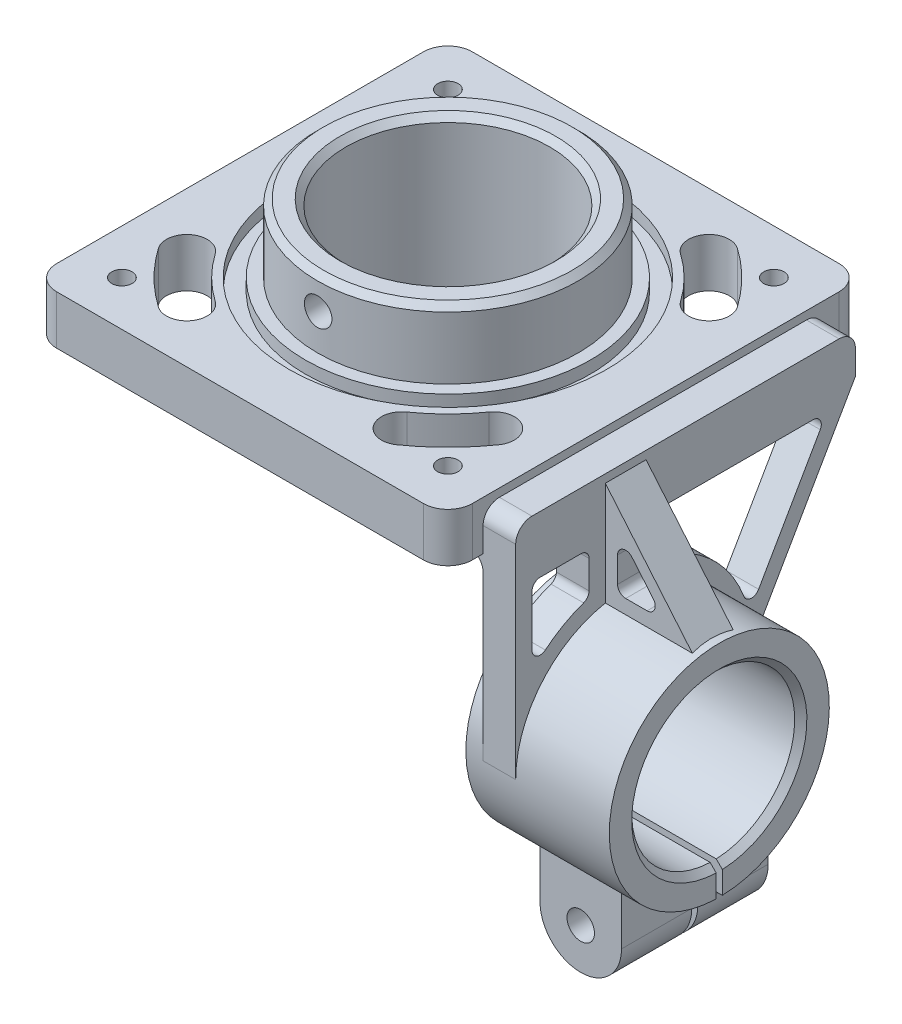
from build123d import *
from build123d.topology import SkipClean

# Parameters (mm, degrees)
ESQUISSE1_W                                        = 161.925
ESQUISSE1_H                                        = 161.925
ESQUISSE1_R                                        = 39.6875
BOSS_EXTRU_1_DEPTH                                 = 19.05
TROU_TARAUD_3_8_161_D                              = 7.9375
ESQUISSE4_R                                        = 61.9125
ESQUISSE4_R_2                                      = 55.5625
ENL_V_MAT_EXTRU_1_DEPTH                            = 4.7625
BOSS_EXTRU_2_START                                 = 26.67
ESQUISSE5_R                                        = 50.8
ESQUISSE5_R_2                                      = 39.6875
BOSS_EXTRU_2_DEPTH                                 = 26.67
CONG_1_R                                           = 9.525
TROU_TARAUD_1_2_131_REACH                          = 158.932
TROU_TARAUD_1_2_131_BORE_R                         = 5.35813
CHANFREIN2_SIZE                                    = 2.38125
ESQUISSE11_R                                       = 53.975
ESQUISSE11_R_2                                     = 39.6875
BOSS_EXTRU_3_DEPTH                                 = 19.05
CHANFREIN4_SIZE                                    = 2.38125
ESQUISSE13_R                                       = 31.75
BOSS_EXTRU_4_DEPTH                                 = 12.7
CONG_2_R                                           = 6.35
CONG_3_R                                           = 6.35
BOSS_EXTRU_6_START                                 = 6.7183
ESQUISSE18_R                                       = 42.8625
ESQUISSE18_R_2                                     = 31.75
BOSS_EXTRU_6_DEPTH                                 = 6.7183
ESQUISSE19_R                                       = 42.8625
ESQUISSE19_R_2                                     = 31.75
BOSS_EXTRU_7_DEPTH                                 = 36.4617
ENL_V_MAT_EXTRU_2_REACH                            = 235.26
NERVURE3_REACH                                     = 215.053
ESQUISSE22_WALL_W                                  = 479.89076251
ESQUISSE22_WALL_H                                  = 15.875
ENL_V_MAT_EXTRU_3_DEPTH                            = 218.087375238
BOSS_EXTRU_8_DEPTH                                 = 57.15
ENL_V_START                                        = -57.15
ENL_V_MAT_EXTRU_4_DEPTH                            = 57.15
ESQUISSE27_W                                       = 2.38125
ESQUISSE27_H                                       = 51.880934265
ENL_V_MAT_EXTRU_5_DEPTH                            = 275.437792492
TROU_TARAUD_1_2_132_D                              = 10.71626
TROU_TARAUD_1_2_132_DEPTH                          = 27.384375
CHANFREIN5_SIZE                                    = 2.38125
CHAMBRAGE_POUR_VIS_T_TE_RONDE_BOMB_E_1_D           = 13.49375
CHAMBRAGE_POUR_VIS_T_TE_RONDE_BOMB_E_1_DEPTH       = 27.384375
CHAMBRAGE_POUR_VIS_T_TE_RONDE_BOMB_E_1_CBORE_D     = 20.6375
CHAMBRAGE_POUR_VIS_T_TE_RONDE_BOMB_E_1_CBORE_DEPTH = 12.7


with BuildPart() as part:
    # Esquisse1 → Boss.-Extru.1 (new body)
    with BuildSketch(Plane(origin=(0, 0, 0), x_dir=(1, 0, 0), z_dir=(0, 1, 0))):
        Rectangle(ESQUISSE1_W, ESQUISSE1_H)
        with Locations(Location((0, 0, 0), (0, 0, 270))):
            Circle(ESQUISSE1_R, mode=Mode.SUBTRACT)
        with BuildLine():
            ThreePointArc((-46.438182228, 66.320597386), (-57.249132772, 57.249132772), (-66.320597386, 46.438182228))
            ThreePointArc((-66.320597386, 46.438182228), (-64.371340998, 35.383399913), (-53.316558683, 37.332656301))
            ThreePointArc((-53.316558683, 37.332656301), (-46.02381262, 46.02381262), (-37.332656301, 53.316558683))
            ThreePointArc((-37.332656301, 53.316558683), (-35.383399913, 64.371340998), (-46.438182228, 66.320597386))
        make_face(mode=Mode.SUBTRACT)
        with BuildLine():
            ThreePointArc((66.320597386, 46.438182228), (57.249132772, 57.249132772), (46.438182228, 66.320597386))
            ThreePointArc((46.438182228, 66.320597386), (35.383399913, 64.371340998), (37.332656301, 53.316558683))
            ThreePointArc((37.332656301, 53.316558683), (46.02381262, 46.02381262), (53.316558683, 37.332656301))
            ThreePointArc((53.316558683, 37.332656301), (64.371340998, 35.383399913), (66.320597386, 46.438182228))
        make_face(mode=Mode.SUBTRACT)
        with BuildLine():
            ThreePointArc((46.438182228, -66.320597386), (57.249132772, -57.249132772), (66.320597386, -46.438182228))
            ThreePointArc((66.320597386, -46.438182228), (64.371340998, -35.383399913), (53.316558683, -37.332656301))
            ThreePointArc((53.316558683, -37.332656301), (46.02381262, -46.02381262), (37.332656301, -53.316558683))
            ThreePointArc((37.332656301, -53.316558683), (35.383399913, -64.371340998), (46.438182228, -66.320597386))
        make_face(mode=Mode.SUBTRACT)
        with BuildLine():
            ThreePointArc((-66.320597386, -46.438182228), (-57.249132772, -57.249132772), (-46.438182228, -66.320597386))
            ThreePointArc((-46.438182228, -66.320597386), (-35.383399913, -64.371340998), (-37.332656301, -53.316558683))
            ThreePointArc((-37.332656301, -53.316558683), (-46.02381262, -46.02381262), (-53.316558683, -37.332656301))
            ThreePointArc((-53.316558683, -37.332656301), (-64.371340998, -35.383399913), (-66.320597386, -46.438182228))
        make_face(mode=Mode.SUBTRACT)
    extrude(amount=-BOSS_EXTRU_1_DEPTH)

    # Trou taraudé 3/8-161 (through all)
    with Locations(Plane(origin=(0, 0, 0), x_dir=(1, 0, 0), z_dir=(0, 1, 0))):
        with Locations((-63.5, 63.5), (63.5, 63.5), (-63.5, -63.5), (63.5, -63.5)):
            Hole(TROU_TARAUD_3_8_161_D / 2)

    # Esquisse4 → Enlèv. mat.-Extru.1 (cut)
    with BuildSketch(Plane(origin=(0, 0, 0), x_dir=(1, 0, 0), z_dir=(0, 1, 0))):
        with Locations(Location((0, 0, 0), (0, 0, 270))):
            Circle(ESQUISSE4_R)
        with Locations(Location((0, 0, 0), (0, 0, 270))):
            Circle(ESQUISSE4_R_2, mode=Mode.SUBTRACT)
    extrude(amount=-ENL_V_MAT_EXTRU_1_DEPTH, mode=Mode.SUBTRACT)

    # Esquisse5 → Boss.-Extru.2 (add)
    with BuildSketch(Plane(origin=(0, 0, 0), x_dir=(1, 0, 0), z_dir=(0, 1, 0)).offset(BOSS_EXTRU_2_START)):
        with Locations(Location((0, 0, 0), (0, 0, 270))):
            Circle(ESQUISSE5_R)
        with Locations(Location((0, 0, 0), (0, 0, 270))):
            Circle(ESQUISSE5_R_2, mode=Mode.SUBTRACT)
    extrude(amount=-BOSS_EXTRU_2_DEPTH)

    # Congé1
    cong_1_edges = [part.edges().sort_by_distance(p)[0] for p in [
        (80.9625, -9.525, 80.9625),
        (-80.9625, -9.525, 80.9625),
        (-80.9625, -9.525, -80.9625),
        (80.9625, -9.525, -80.9625),
    ]]
    fillet(cong_1_edges, radius=CONG_1_R)

    # Trou taraudé 1/2-131 bore → Trou taraudé 1/2-131 (cut, up to next)
    with BuildSketch(Plane.XY.offset(50.8), mode=Mode.PRIVATE) as trou_taraud_1_2_131_sk1:
        with Locations((0, 13.97)):
            Circle(TROU_TARAUD_1_2_131_BORE_R)
    trou_taraud_1_2_131_tool1 = extrude(trou_taraud_1_2_131_sk1.sketch, amount=-TROU_TARAUD_1_2_131_REACH, mode=Mode.PRIVATE) & part.part
    add(trou_taraud_1_2_131_tool1.solids().sort_by_distance((0, 13.97, 50.8))[0], mode=Mode.SUBTRACT)

    # Chanfrein2
    chanfrein2_edges = [part.edges().sort_by_distance(p)[0] for p in [
        (0, 26.67, -50.8),
        (0, 26.67, -39.6875),
    ]]
    chamfer(chanfrein2_edges, length=CHANFREIN2_SIZE)

    # Esquisse11 → Boss.-Extru.3 (add)
    with BuildSketch(Plane(origin=(0, -19.05, 0), x_dir=(-1, 0, 0), z_dir=(0, -1, 0))):
        with Locations(Location((0, 0, 0), (0, 0, 90))):
            Circle(ESQUISSE11_R)
        with Locations(Location((0, 0, 0), (0, 0, 270))):
            Circle(ESQUISSE11_R_2, mode=Mode.SUBTRACT)
    extrude(amount=BOSS_EXTRU_3_DEPTH)

    # Chanfrein4
    chanfrein4_edges = [part.edges().sort_by_distance(p)[0] for p in [
        (0, -38.1, -39.6875),
    ]]
    chamfer(chanfrein4_edges, length=CHANFREIN4_SIZE)

    # Esquisse13 → Boss.-Extru.4 (add)
    with BuildSketch(Plane(origin=(80.9625, 0, 0), x_dir=(0, 0, -1), z_dir=(1, 0, 0))):
        with BuildLine():
            Line((-67.2465, -88.9), (-67.2465, -3.175))
            Line((-67.2465, -3.175), (65.0875, -3.175))
            Line((65.0875, -3.175), (65.0875, -19.05))
            Line((65.0875, -19.05), (12.797587815, -110.22424521))
            ThreePointArc((12.797587815, -110.22424521), (-35.417995163, -130.317929173), (-67.2465, -88.9))
        make_face()
        with Locations((-24.384, -88.9)):
            Circle(ESQUISSE13_R, mode=Mode.SUBTRACT)
    extrude(amount=BOSS_EXTRU_4_DEPTH)

    # Congé2
    cong_2_edges = [part.edges().sort_by_distance(p)[0] for p in [
        (87.3125, -3.175, -65.0875),
        (87.3125, -3.175, 67.2465),
    ]]
    fillet(cong_2_edges, radius=CONG_2_R)

    # Congé3
    # the kernel refuses this fillet: 6.35 mm, written as the material it adds along each edge
    with BuildSketch(Plane(origin=(80.9625, -19.05, 67.2465), x_dir=(-1, 0, 0), z_dir=(0, 0, -1))) as cong_3_piece_1_section:
        with BuildLine():
            CenterArc((CONG_3_R, -CONG_3_R), CONG_3_R, 90, 90)
            Line((0, -CONG_3_R), (0, 0))
            Line((0, 0), (CONG_3_R, 0))
        make_face()
    cong_3_piece_1 = extrude(amount=148.209, mode=Mode.PRIVATE)
    cong_3_piece_1 = split(cong_3_piece_1, bisect_by=Plane(origin=(78.073418061, -76.067337116, -32.387130023), z_dir=(0, 0.4975035336358329, 0.8674619496092378)), keep=Keep.TOP, mode=Mode.PRIVATE)
    add(cong_3_piece_1)

    # Esquisse18 → Boss.-Extru.6 (add)
    with SkipClean():  # the faces are left unmerged after this step: merging them gives an invalid solid
        with BuildSketch(Plane.ZY.offset(-80.9625).offset(BOSS_EXTRU_6_START)):
            with Locations((24.384, -88.9)):
                Circle(ESQUISSE18_R)
            with Locations(Location((24.384, -88.9, 0), (0, 0, 180))):
                Circle(ESQUISSE18_R_2, mode=Mode.SUBTRACT)
        extrude(amount=-BOSS_EXTRU_6_DEPTH)

    # Esquisse19 → Boss.-Extru.7 (add)
    with BuildSketch(Plane(origin=(93.6625, 0, 0), x_dir=(0, 0, -1), z_dir=(1, 0, 0))):
        with Locations((-24.384, -88.9)):
            Circle(ESQUISSE19_R)
        with Locations((-24.384, -88.9)):
            Circle(ESQUISSE19_R_2, mode=Mode.SUBTRACT)
    extrude(amount=BOSS_EXTRU_7_DEPTH)

    # Esquisse20 → Enlèv. mat.-Extru.2 (cut, up to next)
    with BuildSketch(Plane(origin=(93.6625, 0, 0), x_dir=(0, 0, -1), z_dir=(1, 0, 0)), mode=Mode.PRIVATE) as enl_v_mat_extru_2_sk1:
        with BuildLine():
            Line((-10.0965, -39.508591334), (-10.0965, -28.575))
            ThreePointArc((-10.0965, -28.575), (-9.16656403, -26.32993597), (-6.9215, -25.4))
            Line((-6.9215, -25.4), (48.644448908, -25.4))
            ThreePointArc((48.644448908, -25.4), (51.391790492, -26.983541794), (51.398640598, -30.154573719))
            Line((51.398640598, -30.154573719), (27.393895624, -72.009960599))
            ThreePointArc((27.393895624, -72.009960599), (24.385317029, -73.595179496), (21.668570363, -71.549757372))
            ThreePointArc((21.668570363, -71.549757372), (10.056585163, -53.747244064), (-7.979833333, -42.502010041))
            ThreePointArc((-7.979833333, -42.502010041), (-9.513876644, -41.341678439), (-10.0965, -39.508591334))
        make_face()
    enl_v_mat_extru_2_tool1 = extrude(enl_v_mat_extru_2_sk1.sketch, amount=-ENL_V_MAT_EXTRU_2_REACH, mode=Mode.PRIVATE) & part.part
    # Esquisse20 → Enlèv. mat.-Extru.2 (cut, up to next)
    with BuildSketch(Plane(origin=(93.6625, 0, 0), x_dir=(0, 0, -1), z_dir=(1, 0, 0)), mode=Mode.PRIVATE) as enl_v_mat_extru_2_sk2:
        with BuildLine():
            Line((-60.8965, -48.488847455), (-60.8965, -28.575))
            ThreePointArc((-60.8965, -28.575), (-59.96656403, -26.32993597), (-57.7215, -25.4))
            Line((-57.7215, -25.4), (-41.8465, -25.4))
            ThreePointArc((-41.8465, -25.4), (-39.60143597, -26.32993597), (-38.6715, -28.575))
            Line((-38.6715, -28.575), (-38.6715, -39.508591334))
            ThreePointArc((-38.6715, -39.508591334), (-39.254123356, -41.341678439), (-40.788166667, -42.502010041))
            ThreePointArc((-40.788166667, -42.502010041), (-48.614559999, -46.066016781), (-55.701045455, -50.938008215))
            ThreePointArc((-55.701045455, -50.938008215), (-59.075324549, -51.360743012), (-60.8965, -48.488847455))
        make_face()
    enl_v_mat_extru_2_tool2 = extrude(enl_v_mat_extru_2_sk2.sketch, amount=-ENL_V_MAT_EXTRU_2_REACH, mode=Mode.PRIVATE) & part.part
    add(enl_v_mat_extru_2_tool1.solids().sort_by_distance((93.6625, -41.833685, -20.896711))[0], mode=Mode.SUBTRACT)
    add(enl_v_mat_extru_2_tool2.solids().sort_by_distance((93.6625, -36.502861, 50.775659))[0], mode=Mode.SUBTRACT)

    # Esquisse22 wall → Nervure3 (add, up to next)
    with BuildSketch(Plane(origin=(110.30585, -26.202727845, 24.384), x_dir=(0.642787609683, -0.766044443122, 0), z_dir=(0.766044443122, 0.642787609683, 0)), mode=Mode.PRIVATE) as nervure3_sk1:
        Rectangle(ESQUISSE22_WALL_W, ESQUISSE22_WALL_H)
    nervure3_tool1 = extrude(nervure3_sk1.sketch, amount=-NERVURE3_REACH, mode=Mode.PRIVATE) - part.part
    add(nervure3_tool1.solids().sort_by_distance((110.30585, -26.202727845, 24.384))[0])

    # Esquisse23 → Enlèv. mat.-Extru.3 (cut, through all)
    with BuildSketch(Plane.XY.offset(32.3215)):
        with BuildLine():
            Line((98.425, -38.1), (98.425, -28.176057706))
            ThreePointArc((98.425, -28.176057706), (100.514086045, -25.192533635), (104.032191107, -26.135207046))
            Line((104.032191107, -26.135207046), (112.359367425, -36.059149339))
            ThreePointArc((112.359367425, -36.059149339), (112.804703542, -39.441812981), (109.927176318, -41.275))
            Line((109.927176318, -41.275), (101.6, -41.275))
            ThreePointArc((101.6, -41.275), (99.35493597, -40.34506403), (98.425, -38.1))
        make_face()
    extrude(amount=-ENL_V_MAT_EXTRU_3_DEPTH, mode=Mode.SUBTRACT)

    # Esquisse25 → Boss.-Extru.8 (add)
    with BuildSketch(Plane.XY.offset(52.959)):
        with BuildLine():
            Line((120.5992, -107.673382388), (88.8492, -107.673382388))
            Line((88.8492, -107.673382388), (88.8492, -139.7))
            ThreePointArc((88.8492, -139.7), (104.7242, -155.575), (120.5992, -139.7))
            Line((120.5992, -139.7), (120.5992, -107.673382388))
        make_face()
    extrude(amount=-BOSS_EXTRU_8_DEPTH)

    # Esquisse26 → Enlèv. mat.-Extru.4 (cut)
    with BuildSketch(Plane(origin=(120.5992, 0, 0), x_dir=(0, 0, -1), z_dir=(1, 0, 0)).offset(ENL_V_START)):
        with BuildLine():
            Line((-49.98912866, -107.673382388), (1.22112866, -107.673382388))
            ThreePointArc((1.22112866, -107.673382388), (-24.384, -120.65), (-49.98912866, -107.673382388))
        make_face()
    extrude(amount=ENL_V_MAT_EXTRU_4_DEPTH, mode=Mode.SUBTRACT)

    # Esquisse27 → Enlèv. mat.-Extru.5 (cut, through all)
    with BuildSketch(Plane(origin=(130.1242, 0, 0), x_dir=(0, 0, -1), z_dir=(1, 0, 0))):
        with Locations((-24.384, -136.406635857)):
            Rectangle(ESQUISSE27_W, ESQUISSE27_H)
    extrude(amount=-ENL_V_MAT_EXTRU_5_DEPTH, mode=Mode.SUBTRACT)

    # Trou taraudé 1/2-132
    with Locations(Plane.XY.offset(52.959)):
        with Locations((104.7242, -139.7)):
            Hole(TROU_TARAUD_1_2_132_D / 2, depth=TROU_TARAUD_1_2_132_DEPTH)

    # Chanfrein5
    chanfrein5_edges = [part.edges().sort_by_distance(p)[0] for p in [
        (130.1242, -66.032284288, 46.409668619),
        (74.2442, -58.725297558, 34.260731874),
    ]]
    chamfer(chanfrein5_edges, length=CHANFREIN5_SIZE)

    # Chambrage pour vis à tête ronde bombée 1/21
    with Locations(Plane(origin=(0, 0, -4.191), x_dir=(-1, 0, 0), z_dir=(0, 0, -1))):
        with Locations((-104.7242, -139.7)):
            CounterBoreHole(CHAMBRAGE_POUR_VIS_T_TE_RONDE_BOMB_E_1_D / 2, CHAMBRAGE_POUR_VIS_T_TE_RONDE_BOMB_E_1_CBORE_D / 2, CHAMBRAGE_POUR_VIS_T_TE_RONDE_BOMB_E_1_CBORE_DEPTH, depth=CHAMBRAGE_POUR_VIS_T_TE_RONDE_BOMB_E_1_DEPTH)


solid = part.part
